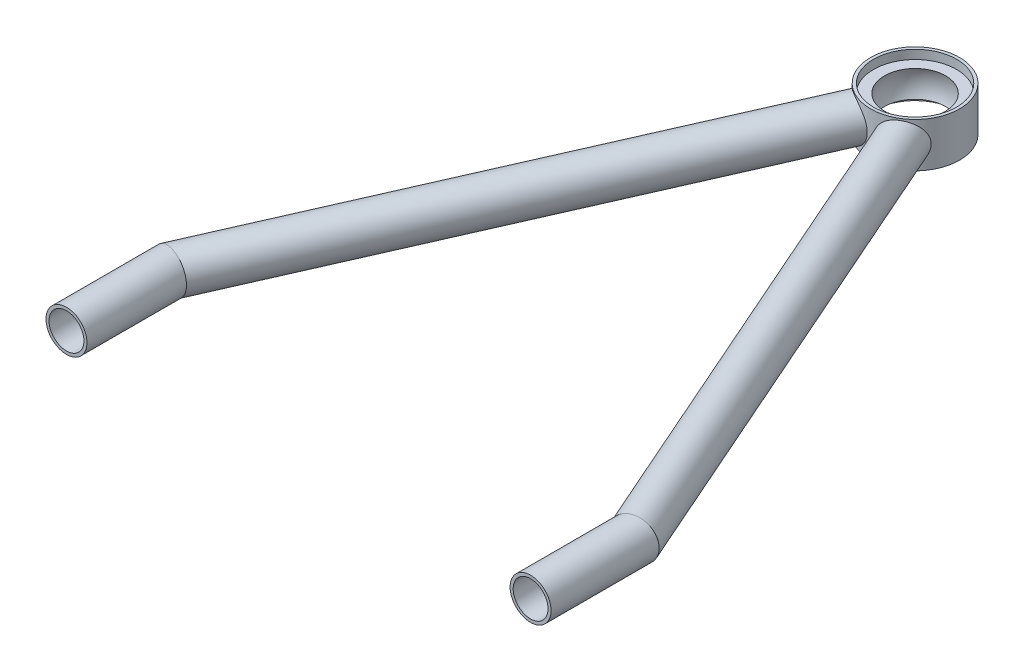
from build123d import *

# Parameters (mm, degrees)
SKETCH1_ON_SEGMENT_1_R                  = 6.9
SKETCH1_ON_SEGMENT_1_R_2                = 5.875
CIRCULAR_TUBE_21_3_X_2_3_1_DEPTH        = 38.053290561
CIRCULAR_TUBE_21_3_X_2_3_1_2_DEPTH      = 178.412650039
CIRCULAR_TUBE_21_3_X_2_3_1_2_DEPTH_BACK = 3.053290561
SKETCH1_R                               = 6.9
SKETCH1_R_2                             = 5.875
SKETCH11_ON_SEGMENT_1_R                 = 6.9
SKETCH11_ON_SEGMENT_1_R_2               = 5.875
CIRCULAR_TUBE_21_3_X_2_3_2_DEPTH        = 38.053290561
CIRCULAR_TUBE_21_3_X_2_3_2_2_DEPTH      = 178.412650039
CIRCULAR_TUBE_21_3_X_2_3_2_2_DEPTH_BACK = 3.053290561
SKETCH11_R                              = 6.9
SKETCH11_R_2                            = 5.875
SKETCH_1_R                              = 15
EXTRUDE_1_DEPTH                         = 7.5
SKETCH_5_R                              = 14
CUT_EXTRUDE_1_DEPTH                     = 3
SKETCH_7_R                              = 14
CUT_EXTRUDE_2_DEPTH                     = 3
WELD_START                              = -8
WELD_TRIM_4_DEPTH                       = 16
WELD_TRIM_4_2_DEPTH                     = 16


with BuildPart() as part:
    # Sketch1 on segment 1 (carried to segment 1) → Circular tube 21.3 X 2.3(1) (new body)
    with BuildSketch(Plane(origin=(-78.21449332, 0, 195.502886979), x_dir=(-1, 0, 0), z_dir=(0, 0, -1))):
        Circle(SKETCH1_ON_SEGMENT_1_R)
        Circle(SKETCH1_ON_SEGMENT_1_R_2, mode=Mode.SUBTRACT)
    extrude(amount=CIRCULAR_TUBE_21_3_X_2_3_1_DEPTH)

    # Circular tube 21.3 X 2.3(1) mitre 1
    split(bisect_by=Plane(origin=(-78.21449332, 0, 160.502886979), x_dir=(0, -1, 0), z_dir=(-0.205910543, 0, 0.978570819)), keep=Keep.TOP)


with BuildPart() as body_2:
    # Sketch1 → Circular tube 21.3 X 2.3_1 2 (new, two sides: drawn at the far end of the back side and taken through both)
    with BuildSketch(Plane(origin=(-78.21449332, 0, 160.502886979), x_dir=(-0.9152016968098962, 0, -0.4029960969491974), z_dir=(0.4029960969491974, 0, -0.9152016968098962)).offset(-CIRCULAR_TUBE_21_3_X_2_3_1_2_DEPTH_BACK)):
        Circle(SKETCH1_R)
        Circle(SKETCH1_R_2, mode=Mode.SUBTRACT)
    extrude(amount=CIRCULAR_TUBE_21_3_X_2_3_1_2_DEPTH + CIRCULAR_TUBE_21_3_X_2_3_1_2_DEPTH_BACK)

    # Circular tube 21.3 X 2.3_1 2 mitre 1
    split(bisect_by=Plane(origin=(-78.21449332, 0, 160.502886979), x_dir=(0, 1, 0), z_dir=(0.205910543, 0, -0.978570819)), keep=Keep.TOP)


with BuildPart() as body_3:
    # Sketch11 on segment 1 (carried to segment 1) → Circular tube 21.3 X 2.3(2) (new body)
    with BuildSketch(Plane(origin=(78.21449332, 0, 195.502886979), x_dir=(-1, 0, 0), z_dir=(0, 0, -1))):
        Circle(SKETCH11_ON_SEGMENT_1_R)
        Circle(SKETCH11_ON_SEGMENT_1_R_2, mode=Mode.SUBTRACT)
    extrude(amount=CIRCULAR_TUBE_21_3_X_2_3_2_DEPTH)

    # Circular tube 21.3 X 2.3(2) mitre 1
    split(bisect_by=Plane(origin=(78.21449332, 0, 160.502886979), x_dir=(0, -1, 0), z_dir=(0.205910543, 0, 0.978570819)), keep=Keep.TOP)


with BuildPart() as body_4:
    # Sketch11 → Circular tube 21.3 X 2.3_2 2 (new, two sides: drawn at the far end of the back side and taken through both)
    with BuildSketch(Plane(origin=(78.21449332, 0, 160.502886979), x_dir=(-0.9152016968098962, 0, 0.40299609694919775), z_dir=(-0.40299609694919775, 0, -0.9152016968098962)).offset(-CIRCULAR_TUBE_21_3_X_2_3_2_2_DEPTH_BACK)):
        Circle(SKETCH11_R)
        Circle(SKETCH11_R_2, mode=Mode.SUBTRACT)
    extrude(amount=CIRCULAR_TUBE_21_3_X_2_3_2_2_DEPTH + CIRCULAR_TUBE_21_3_X_2_3_2_2_DEPTH_BACK)

    # Circular tube 21.3 X 2.3_2 2 mitre 1
    split(bisect_by=Plane(origin=(78.21449332, 0, 160.502886979), x_dir=(0, 1, 0), z_dir=(-0.205910543, 0, -0.978570819)), keep=Keep.TOP)


with BuildPart() as body_5:
    # 스케치1 → 보스-돌출1 (new, symmetric)
    with BuildSketch(Plane(origin=(0, 0, 0), x_dir=(1, 0, 0), z_dir=(0, 1, 0))):
        with Locations(Location((0, 12.307113021, 0), (0, 0, 270))):
            Circle(SKETCH_1_R)
    extrude(amount=EXTRUDE_1_DEPTH, both=True)


with BuildPart() as cut_extrude_1_tool:
    # 스케치5 → 컷-돌출1 (new body)
    with BuildSketch(Plane(origin=(0, 7.5, 0), x_dir=(1, 0, 0), z_dir=(0, 1, 0))):
        with Locations(Location((0, 12.307113021, 0), (0, 0, 270))):
            Circle(SKETCH_5_R)
    extrude(amount=-CUT_EXTRUDE_1_DEPTH)


with BuildPart() as body_2_1:
    add(body_2.part)

    # 컷-돌출1: cut by cut_extrude_1_tool
    add(cut_extrude_1_tool.part, mode=Mode.SUBTRACT)


with BuildPart() as body_4_1:
    add(body_4.part)

    # 컷-돌출1: cut by cut_extrude_1_tool
    add(cut_extrude_1_tool.part, mode=Mode.SUBTRACT)


with BuildPart() as body_5_1:
    add(body_5.part)

    # 컷-돌출1: cut by cut_extrude_1_tool
    add(cut_extrude_1_tool.part, mode=Mode.SUBTRACT)


with BuildPart() as cut_extrude_2_tool:
    # 스케치7 → 컷-돌출2 (new body)
    with BuildSketch(Plane.XZ.offset(7.5)):
        with Locations(Location((0, -12.307113021, 0), (0, 0, 90))):
            Circle(SKETCH_7_R)
    extrude(amount=-CUT_EXTRUDE_2_DEPTH)


with BuildPart() as body_2_2:
    add(body_2_1.part)

    # 컷-돌출2: cut by cut_extrude_2_tool
    add(cut_extrude_2_tool.part, mode=Mode.SUBTRACT)

    # Weld Trim 4 2 outline → Weld Trim 4 2 (cut)
    with BuildSketch(Plane(origin=(0, 0, 0), x_dir=(1, 0, 0), z_dir=(0, 1, 0)).offset(WELD_START)):
        with BuildLine():
            ThreePointArc((-12.974565083, 4.779785413), (-7.986153794, -0.39018384), (-1.165795873, -2.647515694))
            Line((-1.165795873, -2.647515694), (1, -2.81635144))
            Line((1, -2.81635144), (1, -0.440335828))
            Line((1, -0.440335828), (0, 0))
            Line((0, 0), (-2.858187499, 1.258562359))
            Line((-2.858187499, 1.258562359), (-9.771595917, 4.302783779))
            Line((-9.771595917, 4.302783779), (-12.629783416, 5.561346138))
            Line((-12.629783416, 5.561346138), (-13.701878842, 6.033428165))
            Line((-13.701878842, 6.033428165), (-12.974565083, 4.779785413))
        make_face()
    extrude(amount=WELD_TRIM_4_2_DEPTH, mode=Mode.SUBTRACT)


with BuildPart() as body_4_2:
    add(body_4_1.part)

    # 컷-돌출2: cut by cut_extrude_2_tool
    add(cut_extrude_2_tool.part, mode=Mode.SUBTRACT)

    # Weld Trim 4: read off the stored shape, not the designer's step
    # Weld Trim 4 outline → Weld Trim 4 (cut)
    with BuildSketch(Plane(origin=(0, 0, 0), x_dir=(1, 0, 0), z_dir=(0, 1, 0)).offset(WELD_START)):
        with BuildLine():
            ThreePointArc((1.165186055, -2.64756322), (7.985591704, -0.390537358), (12.974205579, 4.779165784))
            Line((12.974205579, 4.779165784), (13.701986356, 6.033475507))
            Line((13.701986356, 6.033475507), (12.629783416, 5.561346138))
            Line((12.629783416, 5.561346138), (9.771595917, 4.302783779))
            Line((9.771595917, 4.302783779), (2.858187499, 1.258562359))
            Line((2.858187499, 1.258562359), (0, 0))
            Line((0, 0), (-1, -0.440335828))
            Line((-1, -0.440335828), (-1, -2.816262599))
            Line((-1, -2.816262599), (1.165186055, -2.64756322))
        make_face()
    extrude(amount=WELD_TRIM_4_DEPTH, mode=Mode.SUBTRACT)


with BuildPart() as body_5_2:
    add(body_5_1.part)

    # 컷-돌출2: cut by cut_extrude_2_tool
    add(cut_extrude_2_tool.part, mode=Mode.SUBTRACT)

    # 스케치9 → 컷-회전1 (revolve, cut)
    with BuildSketch(Plane(origin=(0, 0, 0), x_dir=(0, 0, -1), z_dir=(1, 0, 0))):
        with BuildLine():
            Line((12.307113021, -11.25), (12.307113021, 11.25))
            ThreePointArc((12.307113021, 11.25), (23.557113021, 0), (12.307113021, -11.25))
        make_face()
    revolve(axis=Axis((0, 7.5, -12.307113021), (0, -1, 0)), mode=Mode.SUBTRACT)


solid = Compound([part.part, body_3.part, body_2_2.part, body_4_2.part, body_5_2.part])
